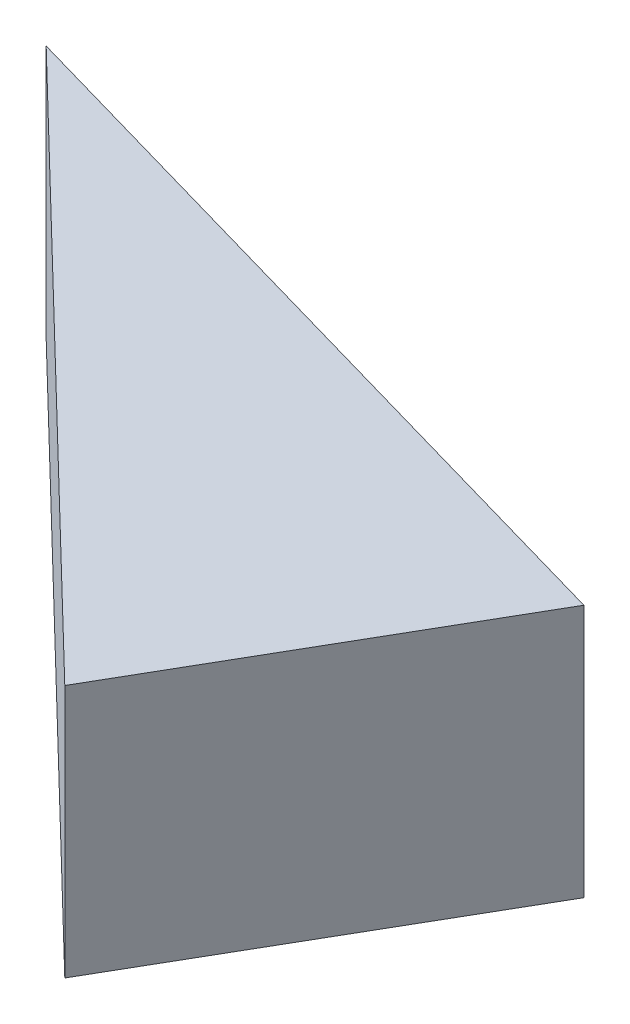
from build123d import *

# Parameters (mm, degrees)
BOSS_EXTRUDE1_DEPTH = 50.8


with BuildPart() as part:
    # Sketch1 → Boss-Extrude1 (new body)
    with BuildSketch(Plane(origin=(0, 0, 0), x_dir=(1, 0, 0), z_dir=(0, 1, 0))):
        Polygon((-112.932271537, 65.201477372), (0, -43.994090512), (38.1, 21.997045256), align=None)
    extrude(amount=BOSS_EXTRUDE1_DEPTH)


solid = part.part
